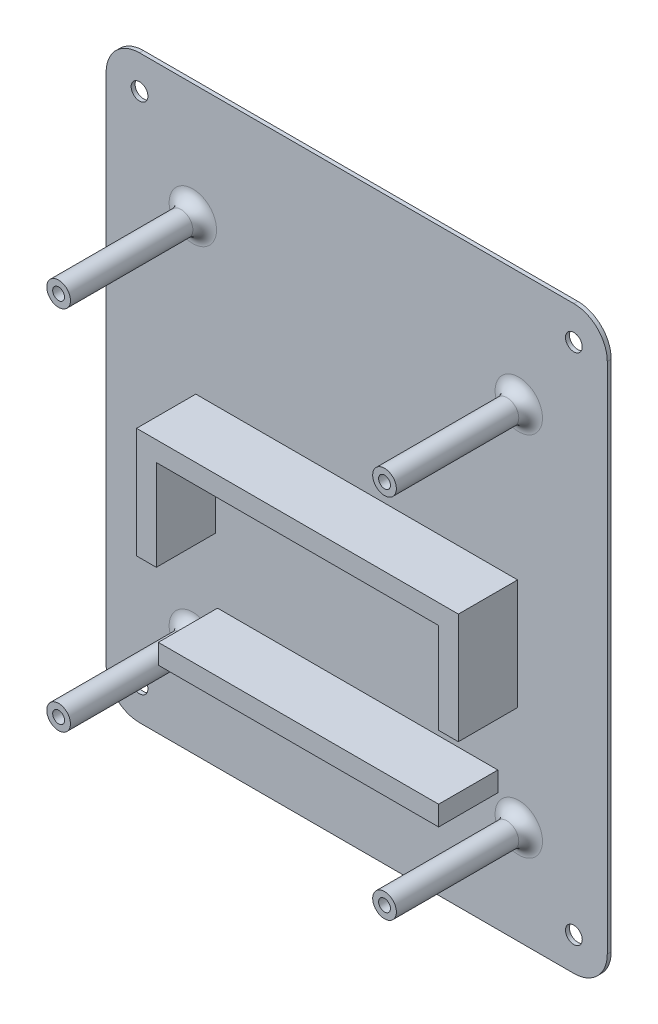
from build123d import *

# Parameters (mm, degrees)
BASE_FLANGE1_DEPTH      = 1
SKETCH7_R               = 2.125
CUT_EXTRUDE1_DEPTH      = 10
SKETCH8_R               = 3
BOSS_EXTRUDE3_DEPTH     = 34
EXTRUDE_THIN1_OUTLINE_W = 71
EXTRUDE_THIN1_OUTLINE_H = 5
EXTRUDE_THIN1_DEPTH     = 15
SKETCH17_R              = 1.5
CUT_EXTRUDE3_DEPTH      = 13
SKETCH15_R              = 1.5
CUT_EXTRUDE4_DEPTH      = 13
SKETCH13_R              = 1.5
CUT_EXTRUDE5_DEPTH      = 13
SKETCH14_R              = 1.5
CUT_EXTRUDE6_DEPTH      = 13
FILLET1_R               = 3
FILLET2_R               = 3
FILLET3_R               = 3
FILLET4_R               = 3


# Read off the part's stored shape, not the designer's step: Extrude-Thin1
# Sheet-metal steps are written as plain solids
with BuildPart() as part:
    # Sketch1 → Base-Flange1 (new body)
    with BuildSketch(Plane.XY):
        with BuildLine():
            Line((-55.005, -73.465), (55.005, -73.465))
            ThreePointArc((55.005, -73.465), (60.987123369, -70.987123369), (63.465, -65.005))
            Line((63.465, -65.005), (63.465, 65.005))
            ThreePointArc((63.465, 65.005), (60.987123369, 70.987123369), (55.005, 73.465))
            Line((55.005, 73.465), (-55.005, 73.465))
            ThreePointArc((-55.005, 73.465), (-60.987123369, 70.987123369), (-63.465, 65.005))
            Line((-63.465, 65.005), (-63.465, -65.005))
            ThreePointArc((-63.465, -65.005), (-60.987123369, -70.987123369), (-55.005, -73.465))
        make_face()
    extrude(amount=-BASE_FLANGE1_DEPTH)

    # Sketch7 → Cut-Extrude1 (cut)
    with BuildSketch(Plane(origin=(0, 0, -1), x_dir=(-1, 0, 0), z_dir=(0, 0, -1))):
        with Locations((55.005, 65.005)):
            Circle(SKETCH7_R)
        with Locations((-55.005, 65.005)):
            Circle(SKETCH7_R)
        with Locations((55.005, -65.005)):
            Circle(SKETCH7_R)
        with Locations((-55.005, -65.005)):
            Circle(SKETCH7_R)
    extrude(amount=-CUT_EXTRUDE1_DEPTH, mode=Mode.SUBTRACT)

    # Sketch8 → Boss-Extrude3 (add)
    with BuildSketch(Plane.XY):
        with Locations((-41.5, -48.465)):
            Circle(SKETCH8_R)
        with Locations((-41.5, 44.372)):
            Circle(SKETCH8_R)
        with Locations((41.05, -48.465)):
            Circle(SKETCH8_R)
        with Locations((41.05, 44.372)):
            Circle(SKETCH8_R)
    extrude(amount=BOSS_EXTRUDE3_DEPTH)

    # Extrude-Thin1 outline → Extrude-Thin1 (add)
    with BuildSketch(Plane.XY):
        with Locations((0.25, -40.965)):
            Rectangle(EXTRUDE_THIN1_OUTLINE_W, EXTRUDE_THIN1_OUTLINE_H)
        Polygon((-40.75, 5.735), (-40.75, -22.265), (-35.75, -22.265), (-35.75, 0.735), (35.75, 0.735), (35.75, -22.265), (40.75, -22.265), (40.75, 5.735), align=None)
    extrude(amount=EXTRUDE_THIN1_DEPTH)

    # Sketch17 → Cut-Extrude3 (cut)
    with BuildSketch(Plane.XY.offset(34)):
        with Locations((41.05, -48.465)):
            Circle(SKETCH17_R)
    extrude(amount=-CUT_EXTRUDE3_DEPTH, mode=Mode.SUBTRACT)

    # Sketch15 → Cut-Extrude4 (cut)
    with BuildSketch(Plane.XY.offset(34)):
        with Locations((-41.5, -48.465)):
            Circle(SKETCH15_R)
    extrude(amount=-CUT_EXTRUDE4_DEPTH, mode=Mode.SUBTRACT)

    # Sketch13 → Cut-Extrude5 (cut)
    with BuildSketch(Plane.XY.offset(34)):
        with Locations((-41.5, 44.372)):
            Circle(SKETCH13_R)
    extrude(amount=-CUT_EXTRUDE5_DEPTH, mode=Mode.SUBTRACT)

    # Sketch14 → Cut-Extrude6 (cut)
    with BuildSketch(Plane.XY.offset(34)):
        with Locations((41.05, 44.372)):
            Circle(SKETCH14_R)
    extrude(amount=-CUT_EXTRUDE6_DEPTH, mode=Mode.SUBTRACT)

    # Fillet1
    fillet1_edges = [part.edges().sort_by_distance(p)[0] for p in [
        (-44.5, -48.465, 0),
    ]]
    fillet(fillet1_edges, radius=FILLET1_R)

    # Fillet2
    fillet2_edges = [part.edges().sort_by_distance(p)[0] for p in [
        (38.05, -48.465, 0),
    ]]
    fillet(fillet2_edges, radius=FILLET2_R)

    # Fillet3
    fillet3_edges = [part.edges().sort_by_distance(p)[0] for p in [
        (-44.5, 44.372, 0),
    ]]
    fillet(fillet3_edges, radius=FILLET3_R)

    # Fillet4
    fillet4_edges = [part.edges().sort_by_distance(p)[0] for p in [
        (38.05, 44.372, 0),
    ]]
    fillet(fillet4_edges, radius=FILLET4_R)


solid = part.part
